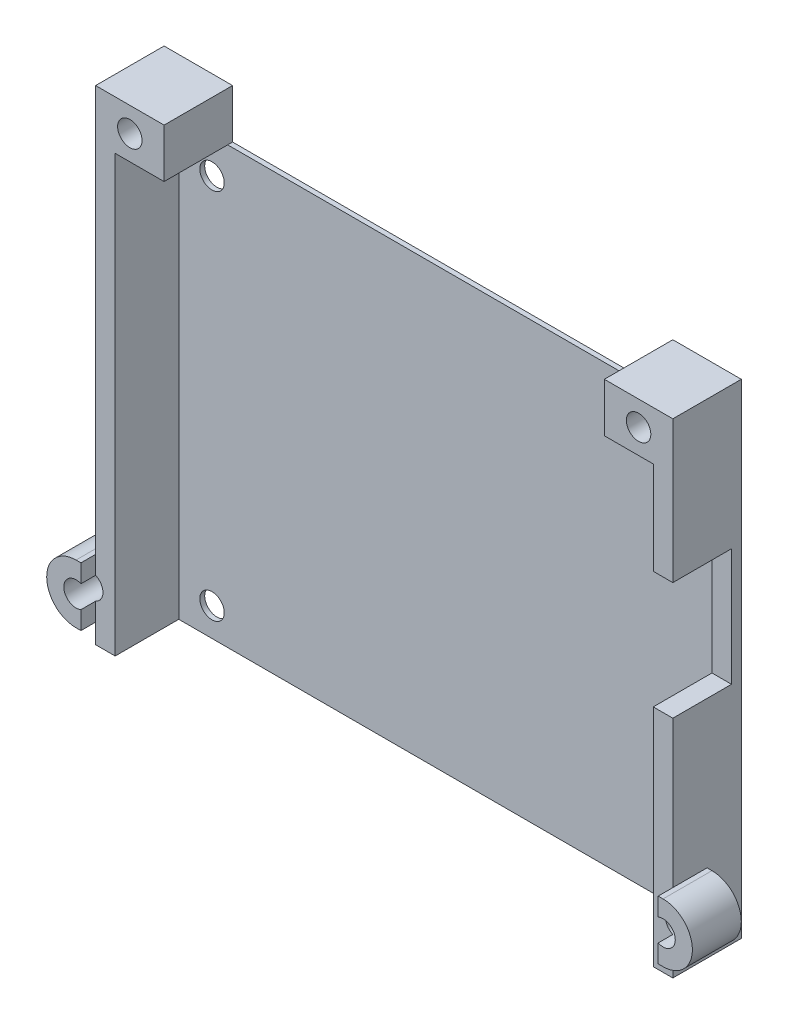
from build123d import *
from build123d.topology import SkipClean

# Parameters (mm, degrees)
BOSS_EXTRUDE1_DEPTH = 44.5
SKETCH2_W           = 6
SKETCH2_H           = 12
CUT_EXTRUDE1_DEPTH  = 10
BOSS_EXTRUDE2_DEPTH = 8.5
CUT_EXTRUDE2_DEPTH  = 11
SKETCH4_W           = 7
SKETCH4_H           = 7
BOSS_EXTRUDE3_DEPTH = 5
SKETCH5_R           = 1.25
CUT_EXTRUDE3_DEPTH  = 81.179486155
SKETCH7_R           = 1.25
CUT_EXTRUDE4_DEPTH  = 10
CUT_EXTRUDE6_DEPTH  = 3.5
BOSS_EXTRUDE4_DEPTH = 3


with BuildPart() as part:
    # Sketch1 → Boss-Extrude1 (new body)
    with BuildSketch(Plane(origin=(0, 0, 0), x_dir=(1, 0, 0), z_dir=(0, 1, 0))):
        Polygon((0, 0), (2, 0), (2, 6.5), (57, 6.5), (57, 0), (59, 0), (59, 7), (0, 7), align=None)
    extrude(amount=BOSS_EXTRUDE1_DEPTH)

    # Sketch2 → Cut-Extrude1 (cut)
    with BuildSketch(Plane(origin=(59, 0, 0), x_dir=(0, 0, -1), z_dir=(1, 0, 0))):
        with Locations((3, 29)):
            Rectangle(SKETCH2_W, SKETCH2_H)
    extrude(amount=-CUT_EXTRUDE1_DEPTH, mode=Mode.SUBTRACT)

    # Sketch3 → Boss-Extrude2 (add)
    with BuildSketch(Plane(origin=(0, 0, -7), x_dir=(-1, 0, 0), z_dir=(0, 0, -1))):
        with BuildLine():
            Line((-59, 6.145643924), (-59, 8))
            Line((-59, 8), (-59.5, 8))
            ThreePointArc((-59.5, 8), (-62.5, 5), (-59.5, 2))
            Line((-59.5, 2), (-59, 2))
            Line((-59, 2), (-59, 3.854356076))
            ThreePointArc((-59, 3.854356076), (-60.75, 5), (-59, 6.145643924))
        make_face()
        with BuildLine():
            Line((0.5, 8), (0, 8))
            Line((0, 8), (0, 6.145643924))
            ThreePointArc((0, 6.145643924), (1.75, 5), (0, 3.854356076))
            Line((0, 3.854356076), (0, 2))
            Line((0, 2), (0.5, 2))
            ThreePointArc((0.5, 2), (3.5, 5), (0.5, 8))
        make_face()
    extrude(amount=-BOSS_EXTRUDE2_DEPTH)

    # Sketch3<3> → Cut-Extrude2 (cut)
    with SkipClean():  # the faces are left unmerged after this step: merging them gives an invalid solid
        with BuildSketch(Plane(origin=(0, 0, -7), x_dir=(-1, 0, 0), z_dir=(0, 0, -1))):
            with BuildLine():
                ThreePointArc((-59, 3.854356076), (-58.25, 5), (-59, 6.145643924))
                Line((-59, 6.145643924), (-59, 3.854356076))
            make_face()
            with BuildLine():
                Line((0, 3.854356076), (0, 6.145643924))
                ThreePointArc((0, 6.145643924), (-0.75, 5), (0, 3.854356076))
            make_face()
        extrude(amount=-CUT_EXTRUDE2_DEPTH, mode=Mode.SUBTRACT)

    # Sketch4 → Boss-Extrude3 (add)
    with SkipClean():  # the faces are left unmerged after this step: merging them gives an invalid solid
        with BuildSketch(Plane(origin=(0, 44.5, 0), x_dir=(1, 0, 0), z_dir=(0, 1, 0))):
            with Locations((3.5, 3.5)):
                Rectangle(SKETCH4_W, SKETCH4_H)
            with Locations((55.5, 3.5)):
                Rectangle(SKETCH4_W, SKETCH4_H)
        extrude(amount=BOSS_EXTRUDE3_DEPTH)

    # Sketch5 → Cut-Extrude3 (cut, through all)
    with SkipClean():  # the faces are left unmerged after this step: merging them gives an invalid solid
        with BuildSketch(Plane(origin=(0, 0, -7), x_dir=(-1, 0, 0), z_dir=(0, 0, -1))):
            with Locations((-55.5, 47)):
                Circle(SKETCH5_R)
            with Locations((-3.5, 47)):
                Circle(SKETCH5_R)
        extrude(amount=-CUT_EXTRUDE3_DEPTH, mode=Mode.SUBTRACT)

    # Sketch7 → Cut-Extrude4 (cut)
    with SkipClean():  # the faces are left unmerged after this step: merging them gives an invalid solid
        with BuildSketch(Plane(origin=(0, 0, -7), x_dir=(-1, 0, 0), z_dir=(0, 0, -1))):
            with Locations((-5.4, 2.9)):
                Circle(SKETCH7_R)
            with Locations((-53.6, 2.9)):
                Circle(SKETCH7_R)
            with Locations((-53.6, 40.95)):
                Circle(SKETCH7_R)
            with Locations((-5.4, 40.95)):
                Circle(SKETCH7_R)
        extrude(amount=-CUT_EXTRUDE4_DEPTH, mode=Mode.SUBTRACT)

    # Sketch3<4> → Cut-Extrude6 (cut)
    with SkipClean():  # the faces are left unmerged after this step: merging them gives an invalid solid
        with BuildSketch(Plane(origin=(0, 0, -7), x_dir=(-1, 0, 0), z_dir=(0, 0, -1))):
            with BuildLine():
                Line((-59, 6.145643924), (-59, 8))
                Line((-59, 8), (-59.5, 8))
                ThreePointArc((-59.5, 8), (-62.5, 5), (-59.5, 2))
                Line((-59.5, 2), (-59, 2))
                Line((-59, 2), (-59, 3.854356076))
                ThreePointArc((-59, 3.854356076), (-60.75, 5), (-59, 6.145643924))
            make_face()
            with BuildLine():
                Line((0.5, 8), (0, 8))
                Line((0, 8), (0, 6.145643924))
                ThreePointArc((0, 6.145643924), (1.75, 5), (0, 3.854356076))
                Line((0, 3.854356076), (0, 2))
                Line((0, 2), (0.5, 2))
                ThreePointArc((0.5, 2), (3.5, 5), (0.5, 8))
            make_face()
        extrude(amount=-CUT_EXTRUDE6_DEPTH, mode=Mode.SUBTRACT)

    # Sketch3<5> → Boss-Extrude4 (add)
    with SkipClean():  # the faces are left unmerged after this step: merging them gives an invalid solid
        with BuildSketch(Plane(origin=(0, 0, -7), x_dir=(-1, 0, 0), z_dir=(0, 0, -1))):
            with BuildLine():
                ThreePointArc((-59, 3.854356076), (-58.25, 5), (-59, 6.145643924))
                Line((-59, 6.145643924), (-59, 3.854356076))
            make_face()
            with BuildLine():
                Line((0, 3.854356076), (0, 6.145643924))
                ThreePointArc((0, 6.145643924), (-0.75, 5), (0, 3.854356076))
            make_face()
        extrude(amount=-BOSS_EXTRUDE4_DEPTH)


solid = part.part
